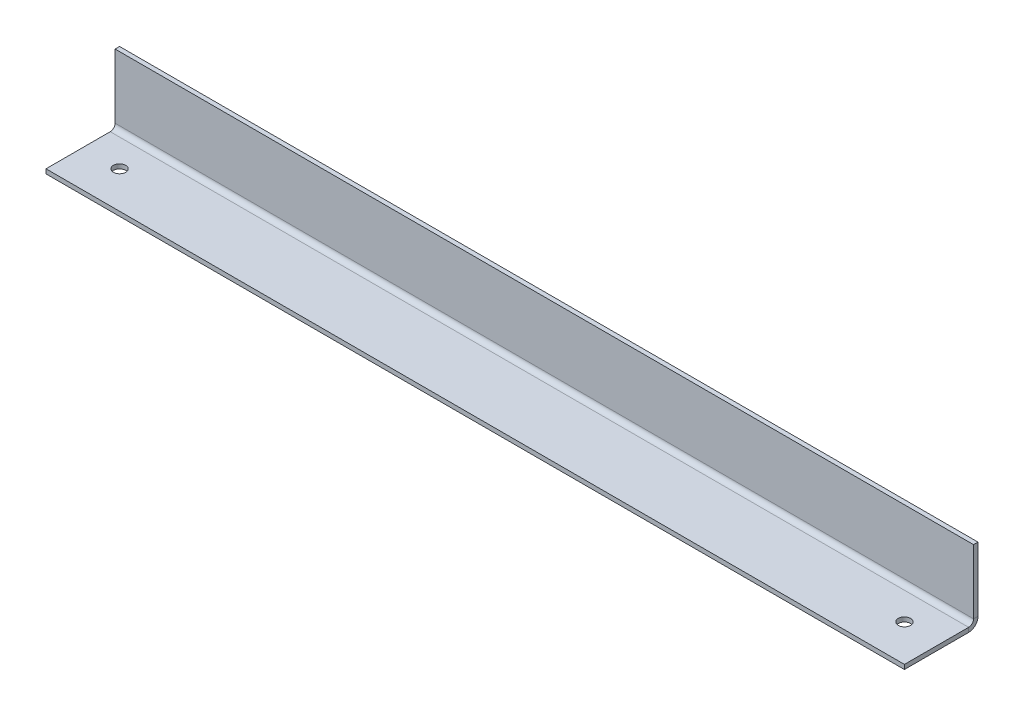
from build123d import *

# Parameters (mm, degrees)
SKETCH1_W                    = 444.5
SKETCH1_H                    = 38.1
BASE_FLANGE1_DEPTH           = 2.304796
EDGE_FLANGE1_STRIP_W         = 14.299184
EDGE_FLANGE1_STRIP_H         = 2.304796
EDGE_FLANGE1_STRIP_CUT_DEPTH = 444.5
EDGE_FLANGE1_DEPTH           = 444.5
F_1_4_0_25_DIAMETER_HOLE1_D  = 6.35


# Sheet-metal steps are written as plain solids
with BuildPart() as part:
    # Sketch1 → Base-Flange1 (new body)
    with BuildSketch(Plane(origin=(0, 0, 0), x_dir=(1, 0, 0), z_dir=(0, 1, 0))):
        with Locations((222.25, 19.05)):
            Rectangle(SKETCH1_W, SKETCH1_H)
    extrude(amount=-BASE_FLANGE1_DEPTH)

    # Edge-Flange1 strip (across the edge) → Edge-Flange1 strip cut (cut)
    with BuildSketch(Plane(origin=(444.5, 0, -38.1), x_dir=(0, 0, 1), z_dir=(-1, 0, 0))):
        with Locations((-2.304796, -1.152398)):
            Rectangle(EDGE_FLANGE1_STRIP_W, EDGE_FLANGE1_STRIP_H)
    extrude(amount=EDGE_FLANGE1_STRIP_CUT_DEPTH, mode=Mode.SUBTRACT)

    # Edge-Flange1 section (across the edge) → Edge-Flange1 (add)
    with BuildSketch(Plane(origin=(444.5, 0, -38.1), x_dir=(0, 0, 1), z_dir=(-1, 0, 0))):
        with BuildLine():
            Line((0, 2.54), (0, 35.795204))
            Line((0, 35.795204), (2.304796, 35.795204))
            Line((2.304796, 35.795204), (2.304796, 2.54))
            ThreePointArc((2.304796, 2.54), (3.048744776, 0.743948776), (4.844796, 0))
            Line((4.844796, 0), (4.844796, -2.304796))
            ThreePointArc((4.844796, -2.304796), (1.419007895, -0.885788105), (0, 2.54))
        make_face()
    extrude(amount=EDGE_FLANGE1_DEPTH)

    # 1/4 (0.25) Diameter Hole1 (through all)
    with Locations(Plane(origin=(0, 0, 0), x_dir=(1, 0, 0), z_dir=(0, 1, 0))):
        with Locations((19.05, 19.05), (425.45, 19.05)):
            Hole(F_1_4_0_25_DIAMETER_HOLE1_D / 2)


solid = part.part
